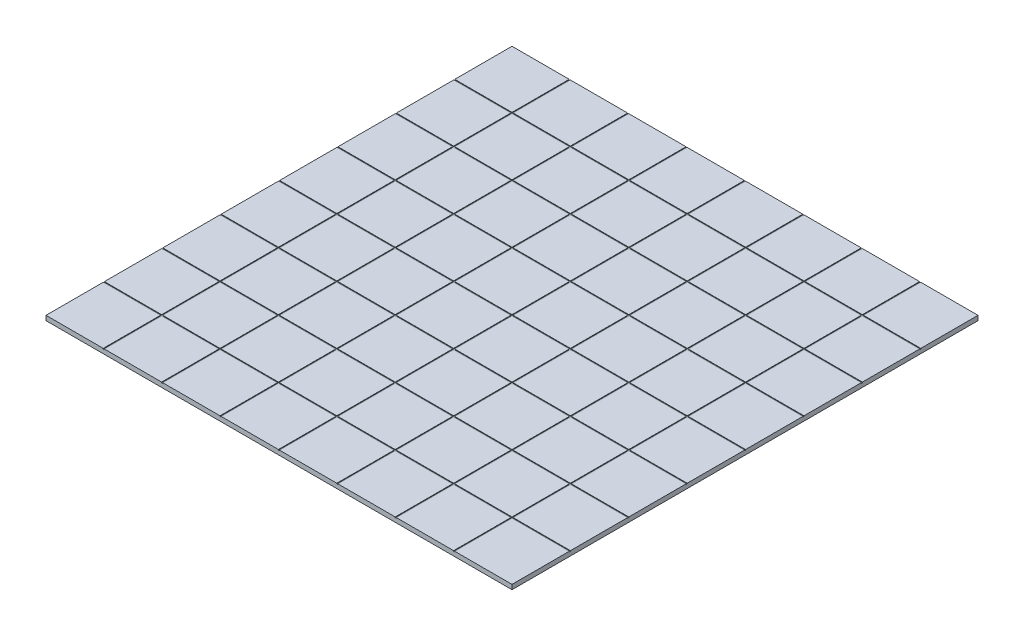
from build123d import *

# Parameters (mm, degrees)
SKETCH1_W           = 200
SKETCH1_H           = 200
BOSS_EXTRUDE1_DEPTH = 2
SKETCH2_W           = 24.5625
SKETCH2_H           = 24.5625
CUT_EXTRUDE1_DEPTH  = 0.25


with BuildPart() as part:
    # Sketch1 → Boss-Extrude1 (new body)
    with BuildSketch(Plane(origin=(0, 0, 0), x_dir=(1, 0, 0), z_dir=(0, 1, 0))):
        with Locations((100, 100)):
            Rectangle(SKETCH1_W, SKETCH1_H)
    extrude(amount=BOSS_EXTRUDE1_DEPTH)

    # Sketch2 → Cut-Extrude1 (cut)
    with BuildSketch(Plane(origin=(0, 2, 0), x_dir=(1, 0, 0), z_dir=(0, 1, 0))):
        Polygon((25.0625, 200), (24.5625, 200), (24.5625, 175.4375), (0, 175.4375), (0, 174.9375), (24.5625, 174.9375), (24.5625, 150.375), (0, 150.375), (0, 149.875), (24.5625, 149.875), (24.5625, 125.3125), (0, 125.3125), (0, 124.8125), (24.5625, 124.8125), (24.5625, 100.25), (0, 100.25), (0, 99.75), (24.5625, 99.75), (24.5625, 75.1875), (0, 75.1875), (0, 74.6875), (24.5625, 74.6875), (24.5625, 50.125), (0, 50.125), (0, 49.625), (24.5625, 49.625), (24.5625, 25.0625), (0, 25.0625), (0, 24.5625), (24.5625, 24.5625), (24.5625, 0), (25.0625, 0), (25.0625, 24.5625), (49.625, 24.5625), (49.625, 0), (50.125, 0), (50.125, 24.5625), (74.6875, 24.5625), (74.6875, 0), (75.1875, 0), (75.1875, 24.5625), (99.75, 24.5625), (99.75, 0), (100.25, 0), (100.25, 24.5625), (124.8125, 24.5625), (124.8125, 0), (125.3125, 0), (125.3125, 24.5625), (149.875, 24.5625), (149.875, 0), (150.375, 0), (150.375, 24.5625), (174.9375, 24.5625), (174.9375, 0), (175.4375, 0), (175.4375, 24.5625), (200, 24.5625), (200, 25.0625), (175.4375, 25.0625), (175.4375, 49.625), (200, 49.625), (200, 50.125), (175.4375, 50.125), (175.4375, 74.6875), (200, 74.6875), (200, 75.1875), (175.4375, 75.1875), (175.4375, 99.75), (200, 99.75), (200, 100.25), (175.4375, 100.25), (175.4375, 124.8125), (200, 124.8125), (200, 125.3125), (175.4375, 125.3125), (175.4375, 149.875), (200, 149.875), (200, 150.375), (175.4375, 150.375), (175.4375, 174.9375), (200, 174.9375), (200, 175.4375), (175.4375, 175.4375), (175.4375, 200), (174.9375, 200), (174.9375, 175.4375), (150.375, 175.4375), (150.375, 200), (149.875, 200), (149.875, 175.4375), (125.3125, 175.4375), (125.3125, 200), (124.8125, 200), (124.8125, 175.4375), (100.25, 175.4375), (100.25, 200), (99.75, 200), (99.75, 175.4375), (75.1875, 175.4375), (75.1875, 200), (74.6875, 200), (74.6875, 175.4375), (50.125, 175.4375), (50.125, 200), (49.625, 200), (49.625, 175.4375), (25.0625, 175.4375), align=None)
        with Locations((37.34375, 162.65625)):
            Rectangle(SKETCH2_W, SKETCH2_H, mode=Mode.SUBTRACT)
        with Locations((62.40625, 162.65625)):
            Rectangle(SKETCH2_W, SKETCH2_H, mode=Mode.SUBTRACT)
        with Locations((37.34375, 137.59375)):
            Rectangle(SKETCH2_W, SKETCH2_H, mode=Mode.SUBTRACT)
        with Locations((87.46875, 162.65625)):
            Rectangle(SKETCH2_W, SKETCH2_H, mode=Mode.SUBTRACT)
        with Locations((62.40625, 137.59375)):
            Rectangle(SKETCH2_W, SKETCH2_H, mode=Mode.SUBTRACT)
        with Locations((37.34375, 112.53125)):
            Rectangle(SKETCH2_W, SKETCH2_H, mode=Mode.SUBTRACT)
        with Locations((112.53125, 162.65625)):
            Rectangle(SKETCH2_W, SKETCH2_H, mode=Mode.SUBTRACT)
        with Locations((87.46875, 137.59375)):
            Rectangle(SKETCH2_W, SKETCH2_H, mode=Mode.SUBTRACT)
        with Locations((62.40625, 112.53125)):
            Rectangle(SKETCH2_W, SKETCH2_H, mode=Mode.SUBTRACT)
        with Locations((37.34375, 87.46875)):
            Rectangle(SKETCH2_W, SKETCH2_H, mode=Mode.SUBTRACT)
        with Locations((137.59375, 162.65625)):
            Rectangle(SKETCH2_W, SKETCH2_H, mode=Mode.SUBTRACT)
        with Locations((112.53125, 137.59375)):
            Rectangle(SKETCH2_W, SKETCH2_H, mode=Mode.SUBTRACT)
        with Locations((87.46875, 112.53125)):
            Rectangle(SKETCH2_W, SKETCH2_H, mode=Mode.SUBTRACT)
        with Locations((62.40625, 87.46875)):
            Rectangle(SKETCH2_W, SKETCH2_H, mode=Mode.SUBTRACT)
        with Locations((37.34375, 62.40625)):
            Rectangle(SKETCH2_W, SKETCH2_H, mode=Mode.SUBTRACT)
        with Locations((162.65625, 162.65625)):
            Rectangle(SKETCH2_W, SKETCH2_H, mode=Mode.SUBTRACT)
        with Locations((137.59375, 137.59375)):
            Rectangle(SKETCH2_W, SKETCH2_H, mode=Mode.SUBTRACT)
        with Locations((112.53125, 112.53125)):
            Rectangle(SKETCH2_W, SKETCH2_H, mode=Mode.SUBTRACT)
        with Locations((87.46875, 87.46875)):
            Rectangle(SKETCH2_W, SKETCH2_H, mode=Mode.SUBTRACT)
        with Locations((62.40625, 62.40625)):
            Rectangle(SKETCH2_W, SKETCH2_H, mode=Mode.SUBTRACT)
        with Locations((37.34375, 37.34375)):
            Rectangle(SKETCH2_W, SKETCH2_H, mode=Mode.SUBTRACT)
        with Locations((162.65625, 137.59375)):
            Rectangle(SKETCH2_W, SKETCH2_H, mode=Mode.SUBTRACT)
        with Locations((137.59375, 112.53125)):
            Rectangle(SKETCH2_W, SKETCH2_H, mode=Mode.SUBTRACT)
        with Locations((112.53125, 87.46875)):
            Rectangle(SKETCH2_W, SKETCH2_H, mode=Mode.SUBTRACT)
        with Locations((87.46875, 62.40625)):
            Rectangle(SKETCH2_W, SKETCH2_H, mode=Mode.SUBTRACT)
        with Locations((62.40625, 37.34375)):
            Rectangle(SKETCH2_W, SKETCH2_H, mode=Mode.SUBTRACT)
        with Locations((162.65625, 112.53125)):
            Rectangle(SKETCH2_W, SKETCH2_H, mode=Mode.SUBTRACT)
        with Locations((137.59375, 87.46875)):
            Rectangle(SKETCH2_W, SKETCH2_H, mode=Mode.SUBTRACT)
        with Locations((112.53125, 62.40625)):
            Rectangle(SKETCH2_W, SKETCH2_H, mode=Mode.SUBTRACT)
        with Locations((87.46875, 37.34375)):
            Rectangle(SKETCH2_W, SKETCH2_H, mode=Mode.SUBTRACT)
        with Locations((162.65625, 87.46875)):
            Rectangle(SKETCH2_W, SKETCH2_H, mode=Mode.SUBTRACT)
        with Locations((137.59375, 62.40625)):
            Rectangle(SKETCH2_W, SKETCH2_H, mode=Mode.SUBTRACT)
        with Locations((112.53125, 37.34375)):
            Rectangle(SKETCH2_W, SKETCH2_H, mode=Mode.SUBTRACT)
        with Locations((162.65625, 62.40625)):
            Rectangle(SKETCH2_W, SKETCH2_H, mode=Mode.SUBTRACT)
        with Locations((137.59375, 37.34375)):
            Rectangle(SKETCH2_W, SKETCH2_H, mode=Mode.SUBTRACT)
        with Locations((162.65625, 37.34375)):
            Rectangle(SKETCH2_W, SKETCH2_H, mode=Mode.SUBTRACT)
    extrude(amount=-CUT_EXTRUDE1_DEPTH, mode=Mode.SUBTRACT)


solid = part.part
